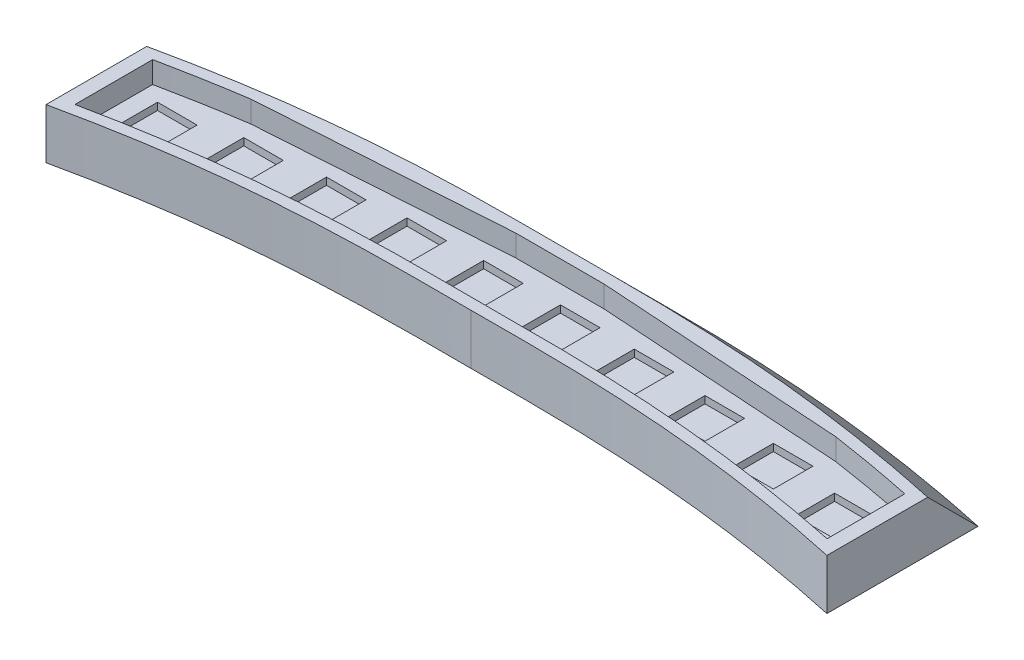
from build123d import *

# Parameters (mm, degrees)
BOSS_EXTRUDE1_DEPTH     = 7
CUT_EXTRUDE1_DEPTH      = 3
CUT_EXTRUDE2_DEPTH      = 59.755326779
CUT_EXTRUDE2_DEPTH_BACK = 1
SKETCH5_W               = 5.5
SKETCH5_H               = 5.5
BOSS_EXTRUDE2_DEPTH     = 7
CUT_LOFT3_START         = -28.140767726
CUT_LOFT3_DEPTH         = 25.989204331


# Read off the part's stored shape, not the designer's step: Cut-Loft3
with BuildPart() as part:
    # Sketch1 → Boss-Extrude1 (new body)
    with BuildSketch(Plane(origin=(0, 0, 0), x_dir=(1, 0, 0), z_dir=(0, 1, 0))):
        with BuildLine():
            Line((-56.7108806, 8.042770274), (-56.7108806, 6.805307476))
            Line((-56.7108806, 6.805307476), (51.827852841, 6.805307476))
            Line((51.827852841, 6.805307476), (51.827852841, 8.042770274))
            add(Edge.make_bspline(
                [(51.827852841, 8.042770274), (43.440678216, 9.870534091), (30.144344491, 11.93787877), (11.99631981, 12.860332352), (2.722791962, 12.844934175), (-2.44151388, 12.817702683)],
                knots=[0, 0, 0, 0, 0.47203113, 0.735860593, 1, 1, 1, 1], degree=3))
            add(Edge.make_bspline(
                [(-56.7108806, 8.042770274), (-48.323705975, 9.870534091), (-35.02737225, 11.93787877), (-16.87934757, 12.860332352), (-7.605819721, 12.844934175), (-2.44151388, 12.817702683)],
                knots=[0, 0, 0, 0, 0.47203113, 0.735860593, 1, 1, 1, 1], degree=3))
        make_face()
        with BuildLine():
            Line((51.827852841, 6.805307476), (-56.7108806, 6.805307476))
            Line((-56.7108806, 6.805307476), (-56.7108806, -1.957229726))
            add(Edge.make_bspline(
                [(-56.7108806, -1.957229726), (-48.323705975, -0.129465909), (-35.02737225, 1.93787877), (-16.87934757, 2.860332352), (-7.605819721, 2.844934175), (-2.44151388, 2.817702683)],
                knots=[0, 0, 0, 0, 0.47203113, 0.735860593, 1, 1, 1, 1], degree=3))
            add(Edge.make_bspline(
                [(51.827852841, -1.957229726), (43.440678216, -0.129465909), (30.144344491, 1.93787877), (11.99631981, 2.860332352), (2.722791962, 2.844934175), (-2.44151388, 2.817702683)],
                knots=[0, 0, 0, 0, 0.47203113, 0.735860593, 1, 1, 1, 1], degree=3))
            Line((51.827852841, -1.957229726), (51.827852841, 6.805307476))
        make_face()
        with BuildLine():
            add(Edge.make_bspline(
                [(-56.7108806, -1.957229726), (-48.323705975, -0.129465909), (-35.02737225, 1.93787877), (-16.87934757, 2.860332352), (-7.605819721, 2.844934175), (-2.44151388, 2.817702683)],
                knots=[0, 0, 0, 0, 0.47203113, 0.735860593, 1, 1, 1, 1], degree=3))
            Line((-56.7108806, -1.957229726), (-56.7108806, -3.957229726))
            add(Edge.make_bspline(
                [(-56.7108806, -3.957229726), (-48.323705975, -2.129465909), (-35.02737225, -0.06212123), (-16.87934757, 0.860332352), (-7.605819721, 0.844934175), (-2.44151388, 0.817702683)],
                knots=[0, 0, 0, 0, 0.47203113, 0.735860593, 1, 1, 1, 1], degree=3))
            add(Edge.make_bspline(
                [(51.827852841, -3.957229726), (43.440678216, -2.129465909), (30.144344491, -0.06212123), (11.99631981, 0.860332352), (2.722791962, 0.844934175), (-2.44151388, 0.817702683)],
                knots=[0, 0, 0, 0, 0.47203113, 0.735860593, 1, 1, 1, 1], degree=3))
            Line((51.827852841, -3.957229726), (51.827852841, -1.957229726))
            add(Edge.make_bspline(
                [(51.827852841, -1.957229726), (43.440678216, -0.129465909), (30.144344491, 1.93787877), (11.99631981, 2.860332352), (2.722791962, 2.844934175), (-2.44151388, 2.817702683)],
                knots=[0, 0, 0, 0, 0.47203113, 0.735860593, 1, 1, 1, 1], degree=3))
        make_face()
        with BuildLine():
            Line((-56.7108806, 10.042770274), (-56.7108806, 8.042770274))
            add(Edge.make_bspline(
                [(-56.7108806, 8.042770274), (-48.323705975, 9.870534091), (-35.02737225, 11.93787877), (-16.87934757, 12.860332352), (-7.605819721, 12.844934175), (-2.44151388, 12.817702683)],
                knots=[0, 0, 0, 0, 0.47203113, 0.735860593, 1, 1, 1, 1], degree=3))
            add(Edge.make_bspline(
                [(51.827852841, 8.042770274), (43.440678216, 9.870534091), (30.144344491, 11.93787877), (11.99631981, 12.860332352), (2.722791962, 12.844934175), (-2.44151388, 12.817702683)],
                knots=[0, 0, 0, 0, 0.47203113, 0.735860593, 1, 1, 1, 1], degree=3))
            Line((51.827852841, 8.042770274), (51.827852841, 10.042770274))
            add(Edge.make_bspline(
                [(51.827852841, 10.042770274), (43.440678216, 11.870534091), (30.144344491, 13.93787877), (11.99631981, 14.860332352), (2.722791962, 14.844934175), (-2.44151388, 14.817702683)],
                knots=[0, 0, 0, 0, 0.47203113, 0.735860593, 1, 1, 1, 1], degree=3))
            add(Edge.make_bspline(
                [(-56.7108806, 10.042770274), (-48.323705975, 11.870534091), (-35.02737225, 13.93787877), (-16.87934757, 14.860332352), (-7.605819721, 14.844934175), (-2.44151388, 14.817702683)],
                knots=[0, 0, 0, 0, 0.47203113, 0.735860593, 1, 1, 1, 1], degree=3))
        make_face()
    extrude(amount=BOSS_EXTRUDE1_DEPTH)

    # Sketch3 → Cut-Extrude1 (cut)
    with BuildSketch(Plane(origin=(0, 7, 0), x_dir=(1, 0, 0), z_dir=(0, 1, 0))):
        with BuildLine():
            Line((-54.7108806, 8.868382777), (-54.7108806, -1.931617223))
            add(Edge.make_bspline(
                [(-54.7108806, -1.931617223), (-49.613724747, -0.872437915), (-41.450567172, 0.513475106), (-30.542278229, 1.675797263), (-21.917454503, 2.210860945), (-12.671997291, 2.467388615), (-2.277076443, 2.389216594), (7.816613622, 2.466322462), (17.198414715, 2.202454548), (25.682964859, 1.677700715), (36.725653994, 0.486844708), (44.753602523, -0.877090687), (49.827852841, -1.931574108)],
                knots=[0.018721889, 0.018721889, 0.018721889, 0.018721889, 0.161718627, 0.245988858, 0.319944032, 0.399040882, 0.499999922, 0.605477206, 0.676291886, 0.757771849, 0.838922396, 0.98127786, 0.98127786, 0.98127786, 0.98127786], degree=3))
            Line((49.827852841, -1.931574108), (49.827852841, 8.868425892))
            add(Edge.make_bspline(
                [(-54.7108806, 8.868382777), (-49.613724747, 9.927562085), (-41.450567172, 11.313475106), (-30.542278229, 12.475797263), (-21.917454503, 13.010860945), (-12.671997291, 13.267388615), (-2.277076443, 13.189216594), (7.816613622, 13.266322462), (17.198414715, 13.002454548), (25.682964859, 12.477700715), (36.725653994, 11.286844708), (44.753602523, 9.922909313), (49.827852841, 8.868425892)],
                knots=[0.018721889, 0.018721889, 0.018721889, 0.018721889, 0.161718627, 0.245988858, 0.319944032, 0.399040882, 0.499999922, 0.605477206, 0.676291886, 0.757771849, 0.838922396, 0.98127786, 0.98127786, 0.98127786, 0.98127786], degree=3))
        make_face()
    extrude(amount=-CUT_EXTRUDE1_DEPTH, mode=Mode.SUBTRACT)

    # Sketch5 → Cut-Extrude2 (cut, two sides: drawn at the far end of the back side and taken through both)
    with BuildSketch(Plane(origin=(0, 4, 0), x_dir=(1, 0, 0), z_dir=(0, 1, 0)).offset(-CUT_EXTRUDE2_DEPTH_BACK)):
        with Locations((-49.494843654, 4.328278982)):
            Rectangle(SKETCH5_W, SKETCH5_H)
        with Locations((-39.246490197, 6.065019164)):
            Rectangle(SKETCH5_W, SKETCH5_H)
        with Locations((-28.744225873, 7.063081882)):
            Rectangle(SKETCH5_W, SKETCH5_H)
        with Locations((-18.235416091, 7.740731917)):
            Rectangle(SKETCH5_W, SKETCH5_H)
        with Locations((-7.78097109, 7.938746568)):
            Rectangle(SKETCH5_W, SKETCH5_H)
        with Locations((2.897943331, 7.938746568)):
            Rectangle(SKETCH5_W, SKETCH5_H)
        with Locations((13.352388332, 7.740731917)):
            Rectangle(SKETCH5_W, SKETCH5_H)
        with Locations((23.861198114, 7.063081882)):
            Rectangle(SKETCH5_W, SKETCH5_H)
        with Locations((34.363462438, 6.065019164)):
            Rectangle(SKETCH5_W, SKETCH5_H)
        with Locations((44.611815895, 4.328278982)):
            Rectangle(SKETCH5_W, SKETCH5_H)
    extrude(amount=CUT_EXTRUDE2_DEPTH + CUT_EXTRUDE2_DEPTH_BACK, mode=Mode.SUBTRACT)

    # Sketch6 → Boss-Extrude2 (add)
    with BuildSketch(Plane.XZ):
        Polygon((-56.7108806, -10.042770274), (-56.7108806, -39.797055232), (51.827852841, -39.797055232), (51.827852841, -10.042770274), (-2.44151388, -13.631270719), align=None)
    extrude(amount=-BOSS_EXTRUDE2_DEPTH)

    # Cut-Loft3 outline → Cut-Loft3 (cut)
    with BuildSketch(Plane(origin=(0, 0, 0), x_dir=(1, 0, 0), z_dir=(0, 0.7071067811865518, 0.7071067811865432)).offset(CUT_LOFT3_START)):
        with BuildLine():
            add(Edge.make_bspline(
                [(51.827852841, 12.051058431), (49.604561047, 12.393258463), (45.142487075, 13.027898019), (38.409103261, 13.825796232), (31.641249387, 14.461164843), (24.84585392, 14.933029584), (18.032893375, 15.237107028), (11.210055122, 15.405236678), (4.384500343, 15.443691251), (-2.441535298, 15.418403963), (-9.267454577, 15.445172671), (-16.093054432, 15.404982103), (-22.915912391, 15.237149433), (-29.728909591, 14.933046954), (-36.524242812, 14.461126298), (-43.292105117, 13.825843609), (-50.025574302, 13.027890419), (-54.487633846, 12.393258899), (-56.7108806, 12.051058431)],
                knots=[0.621766015, 0.621766015, 0.621766015, 0.621766015, 0.645405639, 0.669045263, 0.692684887, 0.716324512, 0.739964136, 0.76360376, 0.787243384, 0.810883008, 0.834522632, 0.858162256, 0.88180188, 0.905441504, 0.929081128, 0.952720752, 0.976360376, 1, 1, 1, 1], degree=3))
            Line((51.827852841, 12.051058431), (51.827852841, 35))
            Line((51.827852841, 35), (-56.7108806, 35))
            Line((-56.7108806, 35), (-56.7108806, 12.051058431))
        make_face()
    extrude(amount=CUT_LOFT3_DEPTH, mode=Mode.SUBTRACT)


solid = part.part
